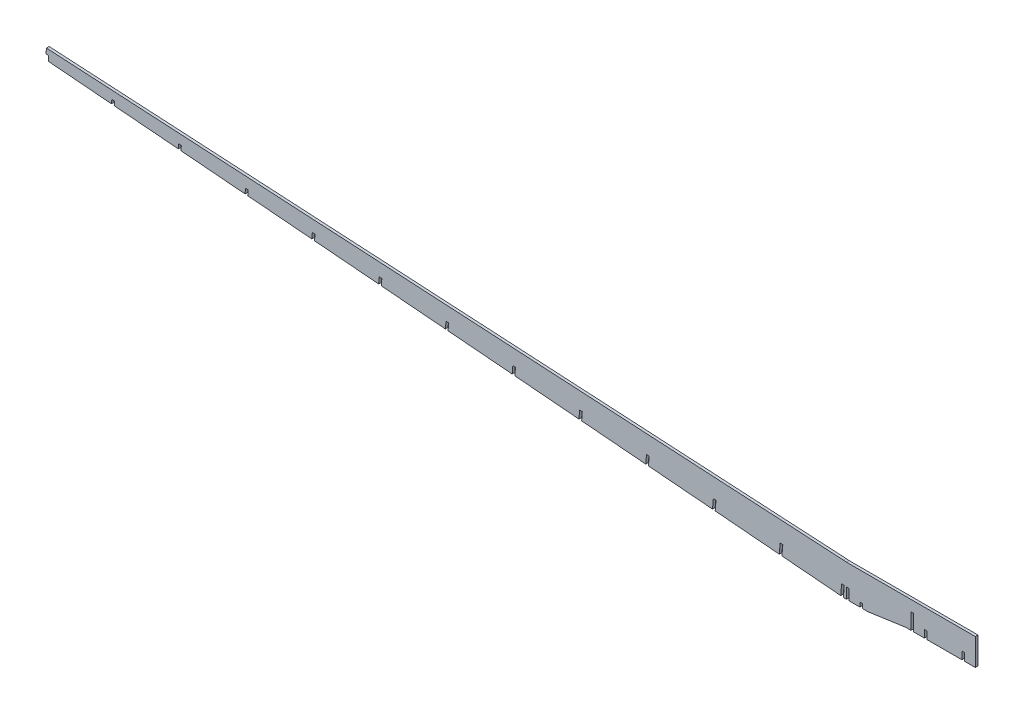
from build123d import *

# Parameters (mm, degrees)
BOSS_EXTRUDE1_DEPTH = 1.5875
CUT_EXTRUDE1_DEPTH  = 955.540658437


with BuildPart() as part:
    # Sketch1 → Boss-Extrude1 (new, symmetric)
    with BuildSketch(Plane.XY):
        Polygon((76.2, 37.697541537), (76.2, 56.747541537), (79.375, 56.747541537), (79.375, 37.697541537), (92.075, 37.697541537), (92.075, 46.587541537), (95.25, 46.587541537), (95.25, 37.697541537), (136.525, 37.697541537), (136.525, 46.587541537), (139.7, 46.587541537), (139.7, 37.697541537), (152.4, 37.697541537), (152.4, 69.447541537), (0, 69.447541537), (-0.423998633, 69.491926731), (-3.587863461, 69.757603883), (-946.051908629, 122.953392794), (-946.583462345, 116.623288424), (-943.412318182, 116.444298555), (-943.91275138, 110.48479854), (-6.775989292, 31.791225946), (-5.713280681, 44.446685258), (-2.549415853, 44.181008106), (-3.612124464, 31.525548794), (-1.492292584, 31.347541537), (0, 31.347541537), (0, 44.047541537), (3.175, 44.047541537), (3.175, 31.347541537), (15.875, 31.347541537), (15.875, 36.427541537), (19.05, 36.427541537), (19.05, 31.347541537), (25.4, 31.347541537), (69.85, 37.697541537), align=None)
    extrude(amount=BOSS_EXTRUDE1_DEPTH, both=True)

    # Sketch2 → Cut-Extrude1 (cut, through all)
    with BuildSketch(Plane.XY.offset(1.5875)):
        Polygon((-76.254460917, 37.625496217), (-75.245037036, 49.646404609), (-78.411328309, 49.883186), (-79.418325745, 37.891173369), align=None)
        Polygon((-155.224527027, 44.256797945), (-154.27566721, 55.556468134), (-157.441958483, 55.793249525), (-158.388391855, 44.522475098), align=None)
        Polygon((-234.194593137, 50.888099674), (-233.306297384, 61.466531659), (-236.472588657, 61.70331305), (-237.358457965, 51.153776826), align=None)
        Polygon((-313.164659247, 57.519401402), (-312.336927558, 67.376595183), (-315.503218831, 67.613376574), (-316.328524075, 57.785078555), align=None)
        Polygon((-392.134725356, 64.15070313), (-391.367557732, 73.286658708), (-394.533849005, 73.523440099), (-395.298590185, 64.416380283), align=None)
        Polygon((-471.104791466, 70.782004859), (-470.398187906, 79.196722233), (-473.564479179, 79.433503624), (-474.268656294, 71.047682011), align=None)
        Polygon((-550.074857576, 77.413306587), (-549.42881808, 85.106785757), (-552.595109353, 85.343567149), (-553.238722404, 77.67898374), align=None)
        Polygon((-629.044923686, 84.044608316), (-628.459448254, 91.016849282), (-631.625739527, 91.253630673), (-632.208788514, 84.310285468), align=None)
        Polygon((-708.014989796, 90.675910044), (-707.490078428, 96.926912807), (-710.656369701, 97.163694198), (-711.178854624, 90.941587197), align=None)
        Polygon((-786.985055905, 97.307211772), (-786.520708602, 102.836976331), (-789.686999875, 103.073757723), (-790.148920734, 97.572888925), align=None)
        Polygon((-865.955122015, 103.938513501), (-865.551338776, 108.747039856), (-868.717630049, 108.983821247), (-869.118986843, 104.204190653), align=None)
    extrude(amount=-CUT_EXTRUDE1_DEPTH, mode=Mode.SUBTRACT)


solid = part.part
